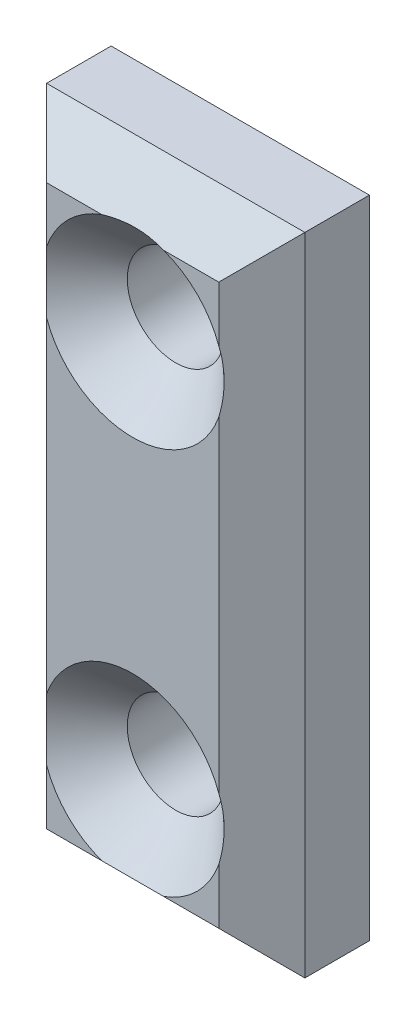
from build123d import *

# Parameters (mm, degrees)
SKETCH1_W           = 12
SKETCH1_H           = 30
BOSS_EXTRUDE1_DEPTH = 5
SKETCH2_R           = 2.25
CUT_EXTRUDE1_DEPTH  = 153.676695316
CHAMFER1_SIZE       = 2


with BuildPart() as part:
    # Sketch1 → Boss-Extrude1 (new body)
    with BuildSketch(Plane.XY):
        with Locations((127.56172091, 58.8)):
            Rectangle(SKETCH1_W, SKETCH1_H)
    extrude(amount=BOSS_EXTRUDE1_DEPTH)

    # Sketch2 → Cut-Extrude1 (cut, through all)
    with BuildSketch(Plane.XY.offset(5)):
        with Locations((127.56172091, 67.8)):
            Circle(SKETCH2_R)
        with Locations((127.56172091, 49.8)):
            Circle(SKETCH2_R)
    extrude(amount=-CUT_EXTRUDE1_DEPTH, mode=Mode.SUBTRACT)

    # Chamfer1
    # the kernel refuses this chamfer: 2 mm, written as the material it takes off along each edge
    with BuildSketch(Plane(origin=(133.56172091, 38.656634024, 5), x_dir=(0.027495876610582174, 0, -0.9996219169112968), z_dir=(0, 1, 0)), Plane(origin=(121.56172091, 78.943365976, 5), x_dir=(-0.02749587661058908, 0, -0.9996219169112968), z_dir=(0, -1, 0))) as chamfer1_piece_1:
        Polygon((CHAMFER1_SIZE * 0.999621916911, CHAMFER1_SIZE * 0.0274958766106), (-CHAMFER1_SIZE * 0.0274958766106, CHAMFER1_SIZE * 0.999621916911), (0, 0), align=None)
    extrude(amount=40.286731952, mode=Mode.SUBTRACT)
    with BuildSketch(Plane(origin=(127.56172091, 67.8, 5), x_dir=(1, 0, 0), z_dir=(0, -1, 0))) as chamfer1_piece_2:
        Polygon((2.25 + CHAMFER1_SIZE, 0), (2.25, -CHAMFER1_SIZE), (2.25, 0), align=None)
    revolve(axis=Axis((127.56172091, 67.8, 5), (0, 0, 1)), mode=Mode.SUBTRACT)
    with BuildSketch(Plane(origin=(138.705086886, 73.8, 5), x_dir=(0, 0.02749587661058908, -0.9996219169112968), z_dir=(-1, 0, 0))) as chamfer1_piece_3:
        Polygon((CHAMFER1_SIZE * 0.999621916911, CHAMFER1_SIZE * 0.0274958766106), (-CHAMFER1_SIZE * 0.0274958766106, CHAMFER1_SIZE * 0.999621916911), (0, 0), align=None)
    extrude(amount=22.286731952, mode=Mode.SUBTRACT)
    with BuildSketch(Plane(origin=(127.56172091, 49.8, 5), x_dir=(1, 0, 0), z_dir=(0, -1, 0))) as chamfer1_piece_4:
        Polygon((2.25 + CHAMFER1_SIZE, 0), (2.25, -CHAMFER1_SIZE), (2.25, 0), align=None)
    revolve(axis=Axis((127.56172091, 49.8, 5), (0, 0, 1)), mode=Mode.SUBTRACT)
    with BuildSketch(Plane(origin=(116.418354934, 43.8, 5), x_dir=(1.1837901526131779e-15, 0.9996219169112968, 0.02749587661058651), z_dir=(1, 0, 0))) as chamfer1_piece_5:
        Polygon((CHAMFER1_SIZE * 0.999621916911, -CHAMFER1_SIZE * 0.0274958766106), (-CHAMFER1_SIZE * 0.0274958766106, -CHAMFER1_SIZE * 0.999621916911), (0, 0), align=None)
    extrude(amount=22.286731952, mode=Mode.SUBTRACT)


solid = part.part
